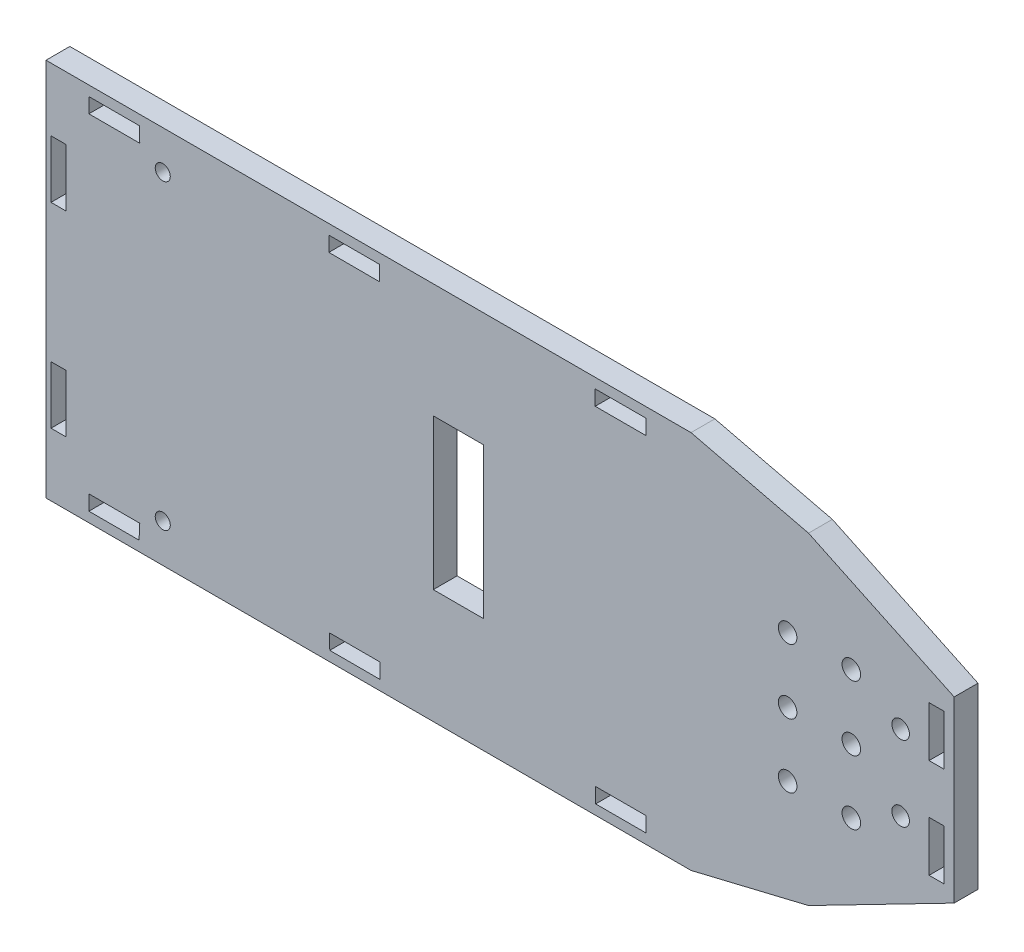
from build123d import *

# Parameters (mm, degrees)
SKETCH1_W           = 181
SKETCH1_H           = 75.57
BOSS_EXTRUDE2_DEPTH = 4.75
SKETCH6_W           = 3
SKETCH6_H           = 11.48294197
SKETCH6_H_2         = 10
SKETCH6_W_2         = 10.095812656
SKETCH6_H_3         = 3.003442242
SKETCH6_W_3         = 10
SKETCH6_H_4         = 30
SKETCH6_R           = 1.5
SKETCH6_R_2         = 1.85
SKETCH6_R_3         = 1.75
CUT_EXTRUDE7_DEPTH  = 9


with BuildPart() as part:
    # Sketch1 → Boss-Extrude2 (new body)
    with BuildSketch(Plane.XY):
        Rectangle(SKETCH1_W, SKETCH1_H)
    extrude(amount=BOSS_EXTRUDE2_DEPTH)

    # Sketch6 → Cut-Extrude7 (cut)
    with BuildSketch(Plane.XY.offset(4.75)):
        Polygon((-81.955185068, 35.785), (-81.955183992, 32.802018857), (-71.81277502, 32.798644215), (-71.859372412, 35.785), align=None)
        with Locations((-88, 19.491470985)):
            Rectangle(SKETCH6_W, SKETCH6_H)
        with Locations((-88, -19.491470985)):
            Rectangle(SKETCH6_W, SKETCH6_H)
        Polygon((-34.13878131, 35.785), (-34.130786214, 32.798291399), (-24.042968654, 32.781557758), (-24.042968654, 35.785), align=None)
        Polygon((-71.81277502, -32.788413815), (-81.955183992, -32.785039173), (-81.955181828, -35.785039173), (-71.955181828, -35.785031959), align=None)
        Polygon((-33.95518398, -32.801010013), (-33.947153334, -35.800999264), (-23.947156396, -35.808824865), (-23.946905936, -32.804340026), align=None)
        with Locations((87, 9.9)):
            Rectangle(SKETCH6_W, SKETCH6_H_2)
        with Locations((24.004937674, 34.283278879)):
            Rectangle(SKETCH6_W_2, SKETCH6_H_3)
        Polygon((29.052844002, -32.806257253), (19.053094123, -32.805423656), (19.052844037, -35.805423646), (29.052844002, -35.806257264), align=None)
        with Locations((-8.31156853, 0)):
            Rectangle(SKETCH6_W_3, SKETCH6_H_4)
        with Locations((87, -9.9)):
            Rectangle(SKETCH6_W, SKETCH6_H_2)
        Polygon((61.46627389, 32.14), (90.5, 18.385572572), (90.5, 37.785), (38.055212144, 37.785), align=None)
        Polygon((61.466273892, -32.14), (38.055212144, -37.785), (90.5, -37.785), (90.5, -17.2), align=None)
        with Locations((-67.23, 30.095)):
            Circle(SKETCH6_R)
        with Locations((-67.23, -30.095)):
            Circle(SKETCH6_R)
        with Locations((70.00651733, -12.753407437)):
            Circle(SKETCH6_R_2)
        with Locations((70.00651733, 12.892480558)):
            Circle(SKETCH6_R_2)
        with Locations((70.00651733, 0)):
            Circle(SKETCH6_R_2)
        with Locations((57.30651733, 12.892480558)):
            Circle(SKETCH6_R_2)
        with Locations((57.30651733, 0)):
            Circle(SKETCH6_R_2)
        with Locations((57.30651733, -12.753407437)):
            Circle(SKETCH6_R_2)
        with Locations((79.833359723, -7.5)):
            Circle(SKETCH6_R_3)
        with Locations((79.833359723, 7.5)):
            Circle(SKETCH6_R_3)
    extrude(amount=-CUT_EXTRUDE7_DEPTH, mode=Mode.SUBTRACT)


solid = part.part
